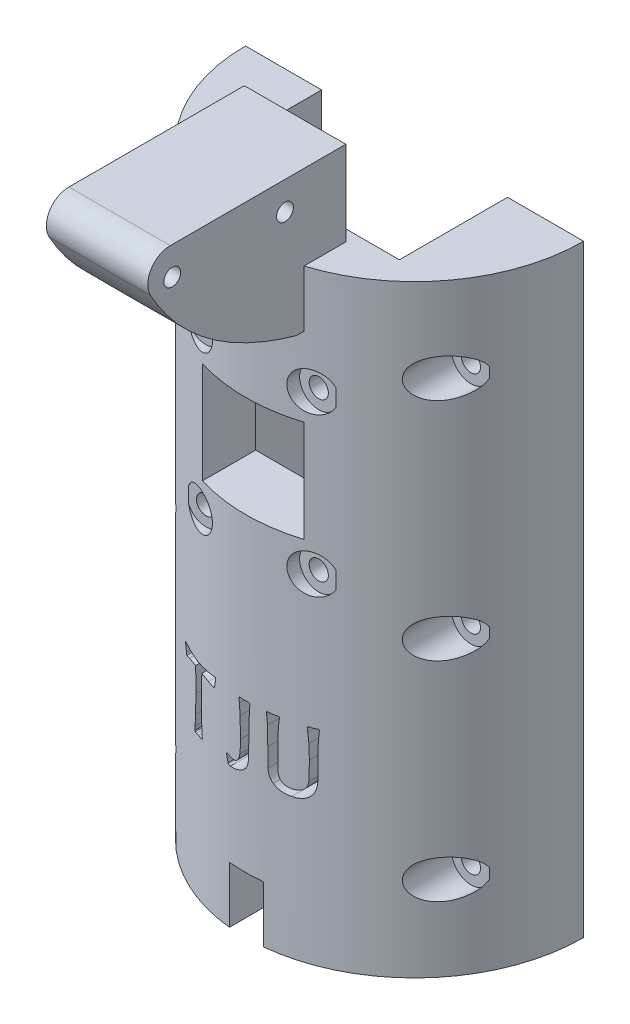
from build123d import *
from build123d.topology import SkipClean

# Parameters (mm, degrees)
EXTRUDE_1_DEPTH      = 80
SKETCH_2_R           = 1.7
CUT_EXTRUDE_1_DEPTH  = 100
SKETCH_3_R           = 1.7
CUT_EXTRUDE_2_DEPTH  = 100
SKETCH_4_R           = 3.4
CUT_EXTRUDE_3_DEPTH  = 26.5
SKETCH_5_R           = 3.4
CUT_EXTRUDE_4_DEPTH  = 13
EXTRUDE_START        = 3
EXTRUDE_2_DEPTH      = 3
EXTRUDE_4_DEPTH      = 9
SKETCH_14_R          = 1.5
CUT_EXTRUDE_6_DEPTH  = 18
SKETCH_18_W          = 18
SKETCH_18_H          = 2
CUT_EXTRUDE_9_DEPTH  = 20
SKETCH_25_W          = 18
SKETCH_25_H          = 38.8
CUT_EXTRUDE_16_DEPTH = 5
FILLET_6_R           = 4
EXTRUDE_START_2      = 19
EXTRUDE_7_DEPTH      = 19
CUT_EXTRUDE_17_REACH = 116.45
SKETCH_29_W          = 30
SKETCH_29_H          = 19.2
EXTRUDE_START_3      = 5
EXTRUDE_9_DEPTH      = 5
SKETCH_31_R          = 3
CUT_EXTRUDE_18_DEPTH = 3
FILLET_7_R           = 1
CHAMFER_3_SIZE       = 2
SKETCH_32_W          = 19.2
SKETCH_32_H          = 102
CUT_EXTRUDE_19_DEPTH = 1.5
SKETCH_33_W          = 19.2
SKETCH_33_H          = 102
CUT_EXTRUDE_20_DEPTH = 1.5
EXTRUDE_10_DEPTH     = 9.5
SKETCH_35_R          = 5
CUT_EXTRUDE_21_DEPTH = 15
SKETCH_36_W          = 6
SKETCH_36_H          = 10
CUT_EXTRUDE_22_DEPTH = 15
SKETCH_39_R          = 1.7
CUT_EXTRUDE_23_DEPTH = 115.450354124
SKETCH_40_R          = 3.4
CUT_EXTRUDE_25_DEPTH = 26.5
SKETCH_41_W          = 18
SKETCH_41_H          = 18
CUT_EXTRUDE_26_DEPTH = 108.354552922
CUT_EXTRUDE_27_DEPTH = 108.354552922
EXTRUDE_11_REACH     = 148.172


with BuildPart() as part:
    # 草图1 → 凸台-拉伸1 (new body)
    with BuildSketch(Plane(origin=(0, 0, 0), x_dir=(1, 0, 0), z_dir=(0, 1, 0))):
        with BuildLine():
            Line((-15, 0), (-30, 0))
            ThreePointArc((-30, 0), (0, -30), (30, 0))
            Line((30, 0), (15, 0))
            Line((15, 0), (15, -19.2))
            Line((15, -19.2), (-15, -19.2))
            Line((-15, -19.2), (-15, 0))
        make_face()
    extrude(amount=EXTRUDE_1_DEPTH)

    # 草图2 → 切除-拉伸1 (cut)
    with BuildSketch(Plane.XY):
        with Locations(Location((-10, 33, 0), (0, 0, 180))):
            Circle(SKETCH_2_R)
        with Locations(Location((-10, 61, 0), (0, 0, 180))):
            Circle(SKETCH_2_R)
        with Locations(Location((10, 33, 0), (0, 0, 180))):
            Circle(SKETCH_2_R)
        with Locations(Location((10, 61, 0), (0, 0, 180))):
            Circle(SKETCH_2_R)
    extrude(amount=CUT_EXTRUDE_1_DEPTH, mode=Mode.SUBTRACT)

    # 草图3 → 切除-拉伸2 (cut)
    with BuildSketch(Plane(origin=(0, 0, 0), x_dir=(-1, 0, 0), z_dir=(0, 0, -1))):
        with Locations((23.5, 65)):
            Circle(SKETCH_3_R)
        with Locations((-23.5, 65)):
            Circle(SKETCH_3_R)
        with Locations((23.5, 25)):
            Circle(SKETCH_3_R)
        with Locations((-23.5, 25)):
            Circle(SKETCH_3_R)
    extrude(amount=-CUT_EXTRUDE_2_DEPTH, mode=Mode.SUBTRACT)

    # 草图4 → 切除-拉伸3 (cut)
    with BuildSketch(Plane(origin=(0, 0, 40), x_dir=(-1, 0, 0), z_dir=(0, 0, -1))):
        with Locations((-23.5, 65)):
            Circle(SKETCH_4_R)
        with Locations((-23.5, 25)):
            Circle(SKETCH_4_R)
        with Locations((23.5, 65)):
            Circle(SKETCH_4_R)
        with Locations((23.5, 25)):
            Circle(SKETCH_4_R)
    extrude(amount=CUT_EXTRUDE_3_DEPTH, mode=Mode.SUBTRACT)

    # 草图5 → 切除-拉伸4 (cut)
    with BuildSketch(Plane(origin=(0, 0, 40), x_dir=(-1, 0, 0), z_dir=(0, 0, -1))):
        with Locations((-10, 33)):
            Circle(SKETCH_5_R)
        with Locations((10, 33)):
            Circle(SKETCH_5_R)
        with Locations((10, 61)):
            Circle(SKETCH_5_R)
        with Locations((-10, 61)):
            Circle(SKETCH_5_R)
    extrude(amount=CUT_EXTRUDE_4_DEPTH, mode=Mode.SUBTRACT)

    # 草图6 → 凸台-拉伸2 (add)
    with SkipClean():  # the faces are left unmerged after this step: merging them gives an invalid solid
        with BuildSketch(Plane.XZ.offset(EXTRUDE_START)):
            with BuildLine():
                Line((-30, 0), (30, 0))
                ThreePointArc((30, 0), (0, 30), (-30, 0))
            make_face()
        extrude(amount=-EXTRUDE_2_DEPTH)

    # 草图13 → 凸台-拉伸4 (add, symmetric)
    with SkipClean():  # the faces are left unmerged after this step: merging them gives an invalid solid
        with BuildSketch(Plane(origin=(0, 0, 0), x_dir=(0, 0, -1), z_dir=(1, 0, 0))):
            with BuildLine():
                Line((-19.2, 100), (-60, 100))
                add(Edge.make_bspline(
                    [(-60, 100), (-54.458111129, 76.859605584), (-30, 70)],
                    knots=[0, 0, 0, 1, 1, 1], degree=2))
                Line((-30, 70), (-19.2, 70))
                Line((-19.2, 70), (-19.2, 100))
            make_face()
        extrude(amount=EXTRUDE_4_DEPTH, both=True)

    # 草图14 → 切除-拉伸6 (cut)
    with SkipClean():  # the faces are left unmerged after this step: merging them gives an invalid solid
        with BuildSketch(Plane.ZY.offset(9)):
            with Locations((32, 90)):
                Circle(SKETCH_14_R)
            with Locations((52, 90)):
                Circle(SKETCH_14_R)
        extrude(amount=-CUT_EXTRUDE_6_DEPTH, mode=Mode.SUBTRACT)

    # 草图18 → 切除-拉伸9 (cut)
    with SkipClean():  # the faces are left unmerged after this step: merging them gives an invalid solid
        with BuildSketch(Plane(origin=(0, 100, 0), x_dir=(1, 0, 0), z_dir=(0, 1, 0))):
            with Locations((0, -20.2)):
                Rectangle(SKETCH_18_W, SKETCH_18_H)
        extrude(amount=-CUT_EXTRUDE_9_DEPTH, mode=Mode.SUBTRACT)

    # 草图25 → 切除-拉伸16 (cut)
    with SkipClean():  # the faces are left unmerged after this step: merging them gives an invalid solid
        with BuildSketch(Plane(origin=(0, 100, 0), x_dir=(1, 0, 0), z_dir=(0, 1, 0))):
            with Locations((0, -40.6)):
                Rectangle(SKETCH_25_W, SKETCH_25_H)
        extrude(amount=-CUT_EXTRUDE_16_DEPTH, mode=Mode.SUBTRACT)

    # 圆角6
    fillet_6_edges = [part.edges().sort_by_distance(p)[0] for p in [
        (4.4999997, 95, 58.513859135),
    ]]
    fillet(fillet_6_edges, radius=FILLET_6_R)

    # 草图28 → 凸台-拉伸7 (add)
    with SkipClean():  # the faces are left unmerged after this step: merging them gives an invalid solid
        with BuildSketch(Plane.XZ.offset(3).offset(EXTRUDE_START_2)):
            with BuildLine():
                Line((-30, 0), (30, 0))
                ThreePointArc((30, 0), (0, 30), (-30, 0))
            make_face()
        extrude(amount=-EXTRUDE_7_DEPTH)

    # 草图29 → 切除-拉伸17 (cut, up to next)
    with BuildSketch(Plane(origin=(0, 0, 0), x_dir=(1, 0, 0), z_dir=(0, 1, 0)), mode=Mode.PRIVATE) as cut_extrude_17_sk1:
        with Locations((0, -9.6)):
            Rectangle(SKETCH_29_W, SKETCH_29_H)
    cut_extrude_17_tool1 = extrude(cut_extrude_17_sk1.sketch, amount=-CUT_EXTRUDE_17_REACH, mode=Mode.PRIVATE) & part.part
    add(cut_extrude_17_tool1.solids().sort_by_distance((0, 0, 9.6))[0], mode=Mode.SUBTRACT)

    # 草图30 → 凸台-拉伸9 (add)
    with SkipClean():  # the faces are left unmerged after this step: merging them gives an invalid solid
        with BuildSketch(Plane.XZ.offset(22).offset(EXTRUDE_START_3)):
            with BuildLine():
                Line((30, 0), (-30, 0))
                ThreePointArc((-30, 0), (0, 30), (30, 0))
            make_face()
        extrude(amount=-EXTRUDE_9_DEPTH)

    # 草图31 → 切除-拉伸18 (cut)
    with SkipClean():  # the faces are left unmerged after this step: merging them gives an invalid solid
        with BuildSketch(Plane(origin=(0, -22, 0), x_dir=(1, 0, 0), z_dir=(0, 1, 0))):
            Circle(SKETCH_31_R)
        extrude(amount=-CUT_EXTRUDE_18_DEPTH, mode=Mode.SUBTRACT)

    # 圆角7
    fillet_7_edges = [part.edges().sort_by_distance(p)[0] for p in [
        (0, -25, 3),
    ]]
    fillet(fillet_7_edges, radius=FILLET_7_R)

    # 倒角3
    chamfer_3_edges = [part.edges().sort_by_distance(p)[0] for p in [
        (0, -22, 3),
    ]]
    chamfer(chamfer_3_edges, length=CHAMFER_3_SIZE - 0.0001)  # a hair under: the kernel refuses the full size

    # 草图32 → 切除-拉伸19 (cut)
    with BuildSketch(Plane.ZY.offset(-15)):
        with Locations((9.6, 29)):
            Rectangle(SKETCH_32_W, SKETCH_32_H)
    extrude(amount=-CUT_EXTRUDE_19_DEPTH, mode=Mode.SUBTRACT)

    # 草图33 → 切除-拉伸20 (cut)
    with BuildSketch(Plane(origin=(-15, 0, 0), x_dir=(0, 0, -1), z_dir=(1, 0, 0))):
        with Locations((-9.6, 29)):
            Rectangle(SKETCH_33_W, SKETCH_33_H)
    extrude(amount=-CUT_EXTRUDE_20_DEPTH, mode=Mode.SUBTRACT)

    # 草图34 → 凸台-拉伸10 (add)
    with BuildSketch(Plane.XZ.offset(27)):
        with BuildLine():
            Line((-6, 0), (6, 0))
            ThreePointArc((6, 0), (0, 6), (-6, 0))
        make_face()
    extrude(amount=EXTRUDE_10_DEPTH)

    # 草图35 → 切除-拉伸21 (cut)
    with BuildSketch(Plane.XZ.offset(27)):
        with Locations(Location((0, 18.5, 0), (0, 0, 270))):
            Circle(SKETCH_35_R)
    extrude(amount=-CUT_EXTRUDE_21_DEPTH, mode=Mode.SUBTRACT)

    # 草图36 → 切除-拉伸22 (cut)
    with BuildSketch(Plane(origin=(0, 0, 19.2), x_dir=(-1, 0, 0), z_dir=(0, 0, -1))):
        with Locations((0, -22)):
            Rectangle(SKETCH_36_W, SKETCH_36_H)
    extrude(amount=-CUT_EXTRUDE_22_DEPTH, mode=Mode.SUBTRACT)

    # 草图39 → 切除-拉伸23 (cut, through all)
    with BuildSketch(Plane(origin=(0, 0, 0), x_dir=(-1, 0, 0), z_dir=(0, 0, -1))):
        with Locations((-23.5, -12)):
            Circle(SKETCH_39_R)
        with Locations((23.5, -12)):
            Circle(SKETCH_39_R)
    extrude(amount=-CUT_EXTRUDE_23_DEPTH, mode=Mode.SUBTRACT)

    # 草图40 → 切除-拉伸25 (cut)
    with BuildSketch(Plane(origin=(0, 0, 40), x_dir=(-1, 0, 0), z_dir=(0, 0, -1))):
        with Locations((-23.5, -12)):
            Circle(SKETCH_40_R)
        with Locations((23.5, -12)):
            Circle(SKETCH_40_R)
    extrude(amount=CUT_EXTRUDE_25_DEPTH, mode=Mode.SUBTRACT)

    # 草图41 → 切除-拉伸26 (cut, through all)
    with BuildSketch(Plane(origin=(0, 0, 40), x_dir=(-1, 0, 0), z_dir=(0, 0, -1))):
        with Locations((0, 47)):
            Rectangle(SKETCH_41_W, SKETCH_41_H)
    extrude(amount=CUT_EXTRUDE_26_DEPTH, mode=Mode.SUBTRACT)

    # 草图43 → 切除-拉伸27 (cut, through all)
    with BuildSketch(Plane(origin=(0, 0, 40), x_dir=(-1, 0, 0), z_dir=(0, 0, -1))):
        with BuildLine():
            add(Edge.make_bspline(
                [(5.85703224, 9.519648867), (5.858467041, 9.502412483), (5.862384195, 9.455355368), (5.878560537, 9.366727745), (5.906137163, 9.242434203), (5.928232605, 9.147531355), (5.940631125, 9.09427807)],
                knots=[0, 0, 0, 0, 0.478148112, 1.305393878, 2.487962906, 4, 4, 4, 4], degree=3))
            add(Edge.make_bspline(
                [(5.940631125, 9.09427807), (5.973233819, 8.951255308), (6.03862516, 8.664394044), (6.076529085, 8.372624541), (6.095534941, 8.226324941)],
                knots=[0, 0, 0, 0, 0.997156331, 2, 2, 2, 2], degree=3))
            add(Edge.make_bspline(
                [(6.095534941, 8.226324941), (6.103411893, 8.181358743), (6.117783107, 8.099319538), (6.178351765, 7.991488751), (6.282121193, 7.931251708), (6.359555236, 7.924826251), (6.400424992, 7.92143489)],
                knots=[0, 0, 0, 0, 1.136989108, 2.074395553, 2.983664298, 4, 4, 4, 4], degree=3))
            add(Edge.make_bspline(
                [(6.400424992, 7.92143489), (6.408632353, 7.92216916), (6.436709982, 7.924681122), (6.494562799, 7.93619372), (6.585664468, 7.950005944), (6.709570808, 7.969681189), (6.86588075, 7.997276158), (7.055243504, 8.029038899), (7.277547265, 8.065598478), (7.436421863, 8.093394636), (7.521633567, 8.108302986)],
                knots=[0, 0, 0, 0, 0.173904883, 0.594933817, 1.243552198, 2.119766021, 3.243472513, 4.594750804, 6.173609309, 8, 8, 8, 8], degree=3))
            add(Edge.make_bspline(
                [(7.521633567, 8.108302986), (7.691956738, 8.135540926), (8.012259045, 8.186763406), (8.462916424, 8.243455806), (8.854047904, 8.267735121), (9.093606631, 8.262944537), (9.203446429, 8.260748011)],
                knots=[0, 0, 0, 0, 1.223498698, 2.300858142, 3.220928408, 4, 4, 4, 4], degree=3))
            add(Edge.make_bspline(
                [(9.203446429, 8.260748011), (9.210278891, 8.130445064), (9.22458498, 7.857611391), (9.241323622, 7.429739874), (9.255966072, 6.965833366), (9.268257485, 6.465046397), (9.277654127, 5.929016105), (9.286004197, 5.356121411), (9.286750559, 4.747953083), (9.288569611, 4.329960295), (9.289504104, 4.115226834)],
                knots=[0, 0, 0, 0, 0.755152602, 1.581169593, 2.478121407, 3.441321042, 4.480296094, 5.580853922, 6.757223506, 8, 8, 8, 8], degree=3))
            add(Edge.make_bspline(
                [(9.289504104, 4.115226834), (9.289240403, 3.807875348), (9.288729157, 3.212005666), (9.278881053, 2.346469525), (9.26176985, 1.537505505), (9.245642118, 1.017139618), (9.237869499, 0.766353854)],
                knots=[0, 0, 0, 0, 1.101138871, 2.134804283, 3.101085324, 4, 4, 4, 4], degree=3))
            add(Edge.make_bspline(
                [(9.237869499, 0.766353854), (9.229221966, 0.604051489), (9.212403119, 0.288384763), (9.181804783, -0.171296269), (9.153594949, -0.604203458), (9.130855099, -0.88352066), (9.119847544, -1.018728219)],
                knots=[0, 0, 0, 0, 1.090173847, 2.120311739, 3.090109524, 4, 4, 4, 4], degree=3))
            add(Edge.make_bspline(
                [(9.119847544, -1.018728219), (9.11561455, -1.070352287), (9.107754739, -1.166207703), (9.098748113, -1.299932398), (9.088400997, -1.412110756), (9.080729439, -1.503058729), (9.076471595, -1.572861981), (9.071762198, -1.621131294), (9.068071716, -1.648954881), (9.068188083, -1.660471512), (9.068212938, -1.662931391)],
                knots=[0, 0, 0, 0, 1.923417826, 3.571396507, 4.976677611, 6.106458477, 6.960802361, 7.572533079, 7.908695778, 8, 8, 8, 8], degree=3))
            add(Edge.make_bspline(
                [(9.068212938, -1.662931391), (9.070298477, -1.697580026), (9.074061196, -1.760092927), (9.106681231, -1.844112661), (9.174488928, -1.89496732), (9.227237146, -1.899199877), (9.255081034, -1.901434093)],
                knots=[0, 0, 0, 0, 1.20974982, 2.182624891, 3.040673024, 4, 4, 4, 4], degree=3))
            add(Edge.make_bspline(
                [(9.255081034, -1.901434093), (9.268206293, -1.900747609), (9.303573331, -1.898897826), (9.37055188, -1.889838214), (9.465066339, -1.881663859), (9.537057432, -1.872255112), (9.57718262, -1.867011022)],
                knots=[0, 0, 0, 0, 0.486650052, 1.31131663, 2.501426745, 4, 4, 4, 4], degree=3))
            add(Edge.make_bspline(
                [(9.57718262, -1.867011022), (9.663952767, -1.85636128), (9.839505839, -1.834814758), (10.016374412, -1.833335873), (10.105822628, -1.832587952)],
                knots=[0, 0, 0, 0, 0.988534648, 2, 2, 2, 2], degree=3))
            add(Edge.make_bspline(
                [(10.105822628, -1.832587952), (10.197882614, -1.834046223), (10.37472372, -1.836847465), (10.548629824, -1.868870217), (10.632003845, -1.884222557)],
                knots=[0, 0, 0, 0, 1.041160493, 2, 2, 2, 2], degree=3))
            add(Edge.make_bspline(
                [(10.632003845, -1.884222557), (10.705678618, -1.89343201), (10.82990157, -1.908960058), (10.954883157, -1.915844319), (11.005740037, -1.918645628)],
                knots=[0, 0, 0, 0, 1.186170037, 2, 2, 2, 2], degree=3))
            add(Edge.make_bspline(
                [(11.005740037, -1.918645628), (11.025750771, -1.917737699), (11.061675748, -1.916107708), (11.108288726, -1.892360211), (11.13929189, -1.851773487), (11.140388989, -1.81840339), (11.140973527, -1.800623672)],
                knots=[0, 0, 0, 0, 1.162316621, 2.086689887, 2.980580887, 4, 4, 4, 4], degree=3))
            add(Edge.make_bspline(
                [(11.140973527, -1.800623672), (11.140071683, -1.796536565), (11.136687401, -1.781199197), (11.136887373, -1.746253567), (11.126723352, -1.689294916), (11.117836822, -1.609763929), (11.108719755, -1.506245847), (11.093301569, -1.381002893), (11.076064883, -1.231842822), (11.063915694, -1.125277939), (11.057374642, -1.067904034)],
                knots=[0, 0, 0, 0, 0.135985939, 0.510303709, 1.128887405, 2.015407267, 3.114029169, 4.510020151, 6.121015412, 8, 8, 8, 8], degree=3))
            add(Edge.make_bspline(
                [(11.057374642, -1.067904034), (11.02436773, -0.764051891), (10.956233839, -0.136830882), (10.922382136, 0.493180826), (10.904929617, 0.817988459)],
                knots=[0, 0, 0, 0, 0.96888382, 2, 2, 2, 2], degree=3))
            add(Edge.make_bspline(
                [(10.904929617, 0.817988459), (10.891836627, 1.067930669), (10.865015209, 1.57994547), (10.839248059, 2.367708145), (10.820798423, 3.193911431), (10.819523939, 3.757871356), (10.818871941, 4.046380693)],
                knots=[0, 0, 0, 0, 0.929842291, 1.904812378, 2.928148678, 4, 4, 4, 4], degree=3))
            add(Edge.make_bspline(
                [(10.818871941, 4.046380693), (10.819493811, 4.29389979), (10.820688144, 4.769272238), (10.825551709, 5.452823181), (10.83290632, 6.076545161), (10.842000052, 6.639648786), (10.855859487, 7.142973485), (10.877272137, 7.586237526), (10.893994432, 7.970123569), (10.913314811, 8.2050559), (10.922141152, 8.312382617)],
                knots=[0, 0, 0, 0, 1.391782816, 2.672986505, 3.843634034, 4.899147726, 5.839693802, 6.674651578, 7.394526524, 8, 8, 8, 8], degree=3))
            add(Edge.make_bspline(
                [(10.922141152, 8.312382617), (11.085352662, 8.306777504), (11.411534895, 8.295575547), (11.898047299, 8.247012115), (12.381259635, 8.17816025), (12.698573667, 8.108636927), (12.85720946, 8.073879915)],
                knots=[0, 0, 0, 0, 1.003129854, 2.004779782, 3.002523341, 4, 4, 4, 4], degree=3))
            add(Edge.make_bspline(
                [(12.85720946, 8.073879915), (12.930961943, 8.054797382), (13.067682692, 8.019422597), (13.257139097, 7.973753388), (13.414578206, 7.933228082), (13.532472325, 7.895878387), (13.632772983, 7.874617173), (13.671080582, 7.853974104), (13.726987451, 7.842782558), (13.712269343, 7.837057071), (13.707951054, 7.835377214)],
                knots=[0, 0, 0, 0, 2.023228837, 3.750617617, 5.192897582, 6.302840761, 7.137627747, 7.668013828, 7.902595332, 8, 8, 8, 8], degree=3))
            add(Edge.make_bspline(
                [(13.707951054, 7.835377214), (13.73216587, 7.839481448), (13.782846668, 7.848071473), (13.840434118, 7.917124698), (13.877166273, 8.017313641), (13.888409436, 8.097189138), (13.894819149, 8.142726056)],
                knots=[0, 0, 0, 0, 0.732569965, 1.533244296, 2.593705774, 4, 4, 4, 4], degree=3))
            add(Edge.make_bspline(
                [(13.894819149, 8.142726056), (13.916179678, 8.29118672), (13.959339311, 8.591156242), (14.052064874, 8.879696017), (14.09889878, 9.025431929)],
                knots=[0, 0, 0, 0, 0.989838319, 2, 2, 2, 2], degree=3))
            add(Edge.make_bspline(
                [(14.09889878, 9.025431929), (14.121449471, 9.090869841), (14.160554974, 9.204346734), (14.205465313, 9.350198281), (14.238026922, 9.442580497), (14.248233684, 9.488457931), (14.251343806, 9.502437332)],
                knots=[0, 0, 0, 0, 1.657740955, 2.874714227, 3.657112006, 4, 4, 4, 4], degree=3))
            add(Edge.make_bspline(
                [(14.251343806, 9.502437332), (14.249551304, 9.52530497), (14.246086841, 9.569502447), (14.201199202, 9.624531722), (14.129771063, 9.650312813), (14.076949283, 9.653238283), (14.047264175, 9.654882357)],
                knots=[0, 0, 0, 0, 0.934583354, 1.806317963, 2.767181093, 4, 4, 4, 4], degree=3))
            add(Edge.make_bspline(
                [(14.047264175, 9.654882357), (14.028414262, 9.654058206), (13.976771919, 9.651800312), (13.876612308, 9.647621547), (13.732630648, 9.633176164), (13.544057516, 9.619329436), (13.311889902, 9.603168566), (13.036004535, 9.576401208), (12.715327964, 9.5510396), (12.486732307, 9.530530128), (12.365451313, 9.519648867)],
                knots=[0, 0, 0, 0, 0.268375882, 0.735258529, 1.42551662, 2.325865387, 3.424704897, 4.735539188, 6.268046483, 8, 8, 8, 8], degree=3))
            add(Edge.make_bspline(
                [(12.365451313, 9.519648867), (12.240075376, 9.508715989), (11.997593787, 9.487571409), (11.645030874, 9.461392495), (11.31567878, 9.435813064), (11.009113561, 9.416422385), (10.725534984, 9.401043175), (10.464824971, 9.392155806), (10.226358376, 9.383438298), (10.074685076, 9.382434137), (10.002553417, 9.381956586)],
                knots=[0, 0, 0, 0, 1.275758837, 2.467363653, 3.583779202, 4.624448483, 5.581208992, 6.462521565, 7.268817456, 8, 8, 8, 8], degree=3))
            add(Edge.make_bspline(
                [(10.002553417, 9.381956586), (9.929604422, 9.382490092), (9.775477792, 9.383617285), (9.53366064, 9.391400144), (9.26810842, 9.404073233), (8.980379078, 9.420890338), (8.669082137, 9.44440504), (8.335228863, 9.4672003), (7.978846994, 9.500377022), (7.733896819, 9.524454812), (7.607691242, 9.536860402)],
                knots=[0, 0, 0, 0, 0.72927492, 1.540811991, 2.418482048, 3.387024563, 4.422046326, 5.539381905, 6.73221677, 8, 8, 8, 8], degree=3))
            add(Edge.make_bspline(
                [(7.607691242, 9.536860402), (7.485587182, 9.547700335), (7.256973303, 9.567995803), (6.93713979, 9.593646301), (6.665331182, 9.62011389), (6.441357322, 9.636254006), (6.265865916, 9.649901771), (6.138355724, 9.664852438), (6.057790499, 9.668199043), (6.020129203, 9.671235169), (6.009477265, 9.672093892)],
                knots=[0, 0, 0, 0, 1.834207314, 3.43416304, 4.800927602, 5.920205504, 6.794019528, 7.434664168, 7.840103157, 8, 8, 8, 8], degree=3))
            add(Edge.make_bspline(
                [(6.009477265, 9.672093892), (5.987162051, 9.670356216), (5.94618554, 9.667165392), (5.889287527, 9.639838605), (5.86196074, 9.582940592), (5.858769916, 9.541964082), (5.85703224, 9.519648867)],
                knots=[0, 0, 0, 0, 1.089171063, 2, 2.910828937, 4, 4, 4, 4], degree=3))
        make_face()
        with BuildLine():
            add(Edge.make_bspline(
                [(-0.776785161, 9.177876955), (-0.776789947, 9.177057099), (-0.776838071, 9.168813133), (-0.773045128, 9.146747745), (-0.768351918, 9.104230718), (-0.764227495, 9.040130169), (-0.756801074, 8.955722985), (-0.746016033, 8.850966725), (-0.737239969, 8.725408634), (-0.729392953, 8.634472144), (-0.725150555, 8.585308388)],
                knots=[0, 0, 0, 0, 0.033067086, 0.332502286, 0.898519627, 1.760803736, 2.922395452, 4.317497343, 6.009097776, 8, 8, 8, 8], degree=3))
            add(Edge.make_bspline(
                [(-0.725150555, 8.585308388), (-0.713938706, 8.453393466), (-0.690486347, 8.177460756), (-0.665066818, 7.742049312), (-0.638873011, 7.267614175), (-0.629301954, 6.93713169), (-0.624340135, 6.765803245)],
                knots=[0, 0, 0, 0, 0.87163953, 1.823249811, 2.871531042, 4, 4, 4, 4], degree=3))
            add(Edge.make_bspline(
                [(-0.624340135, 6.765803245), (-0.619985942, 6.633855129), (-0.611062121, 6.363430441), (-0.60231242, 5.947842405), (-0.591629974, 5.513491265), (-0.584327639, 5.059420632), (-0.580278079, 4.586493188), (-0.574514459, 4.094748741), (-0.57222354, 3.584130101), (-0.572542604, 3.237438571), (-0.57270553, 3.060405609)],
                knots=[0, 0, 0, 0, 0.8549669, 1.752235381, 2.691954866, 3.668718843, 4.69317817, 5.754790134, 6.853516402, 8, 8, 8, 8], degree=3))
            add(Edge.make_bspline(
                [(-0.57270553, 3.060405609), (-0.572872379, 2.90468227), (-0.573189394, 2.608805529), (-0.571067866, 2.187518664), (-0.56538685, 1.812157447), (-0.56126684, 1.481834531), (-0.554453456, 1.196561071), (-0.54374046, 0.956486793), (-0.535702802, 0.761225955), (-0.525515052, 0.64666945), (-0.521070924, 0.596697293)],
                knots=[0, 0, 0, 0, 1.516274391, 2.880944677, 4.102048895, 5.171540464, 6.097575414, 6.880304974, 7.511563528, 8, 8, 8, 8], degree=3))
            add(Edge.make_bspline(
                [(-0.521070924, 0.596697293), (-0.511331341, 0.500693474), (-0.492628061, 0.316333808), (-0.450867438, 0.051046102), (-0.397607766, -0.192316708), (-0.331509125, -0.414381749), (-0.253678251, -0.614985564), (-0.161128801, -0.792420928), (-0.063330275, -0.952449006), (0.01765121, -1.041922416), (0.056744898, -1.085115569)],
                knots=[0, 0, 0, 0, 1.278825999, 2.45577659, 3.557476532, 4.578220771, 5.524324972, 6.403714446, 7.229395581, 8, 8, 8, 8], degree=3))
            add(Edge.make_bspline(
                [(0.056744898, -1.085115569), (0.140842744, -1.168488236), (0.309090913, -1.335285597), (0.59669309, -1.545219849), (0.907143063, -1.72500565), (1.243907269, -1.868764273), (1.603864428, -1.9856808), (1.990447393, -2.066159925), (2.401314597, -2.112038115), (2.683437069, -2.119107686), (2.827802055, -2.122725259)],
                knots=[0, 0, 0, 0, 0.932353484, 1.86528878, 2.797261652, 3.755033065, 4.745961936, 5.776130153, 6.862022799, 8, 8, 8, 8], degree=3))
            add(Edge.make_bspline(
                [(2.827802055, -2.122725259), (2.882255049, -2.120416277), (2.982698823, -2.116157138), (3.119533478, -2.072484184), (3.225414518, -1.993467225), (3.265319082, -1.920473755), (3.285137132, -1.884222557)],
                knots=[0, 0, 0, 0, 1.189903504, 2.194891271, 3.103517705, 4, 4, 4, 4], degree=3))
            add(Edge.make_bspline(
                [(3.285137132, -1.884222557), (3.307909568, -1.777636389), (3.352785285, -1.567596029), (3.39971463, -1.358005004), (3.422829413, -1.25477213)],
                knots=[0, 0, 0, 0, 1.014911304, 2, 2, 2, 2], degree=3))
            add(Edge.make_bspline(
                [(3.422829413, -1.25477213), (3.435525906, -1.208977527), (3.459270647, -1.123333327), (3.486434611, -1.002655956), (3.515488855, -0.902766582), (3.53402572, -0.820131833), (3.551016604, -0.757087493), (3.564283657, -0.713258675), (3.569625748, -0.687815204), (3.574427437, -0.67858456), (3.575274439, -0.676956307)],
                knots=[0, 0, 0, 0, 1.907736555, 3.567812814, 4.964700659, 6.08207527, 6.968114903, 7.582862527, 7.926418414, 8, 8, 8, 8], degree=3))
            add(Edge.make_bspline(
                [(3.575274439, -0.676956307), (3.57378562, -0.64687573), (3.571046259, -0.59152879), (3.528683454, -0.519801674), (3.455983627, -0.480104038), (3.401199323, -0.477022938), (3.371194808, -0.475335467)],
                knots=[0, 0, 0, 0, 1.091159656, 2.007685779, 2.908840344, 4, 4, 4, 4], degree=3))
            add(Edge.make_bspline(
                [(3.371194808, -0.475335467), (3.358040858, -0.47846823), (3.317143207, -0.488208471), (3.235696806, -0.516836312), (3.113961702, -0.567396921), (3.018007762, -0.605786831), (2.963035546, -0.627780492)],
                knots=[0, 0, 0, 0, 0.371943426, 1.156429287, 2.37091227, 4, 4, 4, 4], degree=3))
            add(Edge.make_bspline(
                [(2.963035546, -0.627780492), (2.833905723, -0.671617602), (2.580106467, -0.757777606), (2.312561564, -0.772831066), (2.181140092, -0.780225518)],
                knots=[0, 0, 0, 0, 1.017574475, 2, 2, 2, 2], degree=3))
            add(Edge.make_bspline(
                [(2.181140092, -0.780225518), (2.108425954, -0.775473863), (1.966898382, -0.766225453), (1.764390494, -0.693540277), (1.585199672, -0.572454646), (1.426836919, -0.40362186), (1.290855953, -0.189289125), (1.172027162, 0.070136816), (1.078903585, 0.376818834), (1.032702807, 0.597920629), (1.008296912, 0.714719248)],
                knots=[0, 0, 0, 0, 0.840613191, 1.63613222, 2.457448301, 3.323451566, 4.297505116, 5.384667271, 6.618431603, 8, 8, 8, 8], degree=3))
            add(Edge.make_bspline(
                [(1.008296912, 0.714719248), (0.999506677, 0.772018162), (0.980226925, 0.897692712), (0.962880659, 1.103069723), (0.945308916, 1.340730493), (0.930420322, 1.609582365), (0.921607346, 1.910474628), (0.914109478, 2.243238365), (0.909326451, 2.607975669), (0.908115424, 2.862061857), (0.907486492, 2.994018259)],
                knots=[0, 0, 0, 0, 0.609164827, 1.336090177, 2.165315449, 3.114362188, 4.165943723, 5.329241217, 6.612975697, 8, 8, 8, 8], degree=3))
            add(Edge.make_bspline(
                [(0.907486492, 2.994018259), (0.908510966, 3.328419128), (0.910489678, 3.974295004), (0.923305803, 4.908658334), (0.940970062, 5.775113619), (0.963199873, 6.329803975), (0.973873842, 6.596146684)],
                knots=[0, 0, 0, 0, 1.113740359, 2.151124882, 3.112235497, 4, 4, 4, 4], degree=3))
            add(Edge.make_bspline(
                [(0.973873842, 6.596146684), (0.982417109, 6.766649251), (0.999017191, 7.097946016), (1.030978863, 7.57992559), (1.067930137, 8.032315513), (1.095688893, 8.323884637), (1.109107332, 8.464827642)],
                knots=[0, 0, 0, 0, 1.093282708, 2.1243142, 3.09330319, 4, 4, 4, 4], degree=3))
            add(Edge.make_bspline(
                [(1.109107332, 8.464827642), (1.115198165, 8.519707102), (1.126552564, 8.622012222), (1.13728797, 8.765743092), (1.150441788, 8.887706957), (1.159898663, 8.989368039), (1.168453154, 9.070413262), (1.170798027, 9.131356431), (1.178493167, 9.170363377), (1.178078881, 9.189343143), (1.177953473, 9.19508849)],
                knots=[0, 0, 0, 0, 1.806239627, 3.36715337, 4.714482847, 5.819029443, 6.707502557, 7.379965633, 7.812309989, 8, 8, 8, 8], degree=3))
            add(Edge.make_bspline(
                [(1.177953473, 9.19508849), (1.174941645, 9.230080125), (1.169357958, 9.294951793), (1.119632594, 9.382060603), (1.027761913, 9.427478871), (0.959552728, 9.431429836), (0.922239237, 9.433591191)],
                knots=[0, 0, 0, 0, 1.05181703, 1.949983884, 2.878549027, 4, 4, 4, 4], degree=3))
            add(Edge.make_bspline(
                [(0.922239237, 9.433591191), (0.912406743, 9.432748184), (0.882909261, 9.430219164), (0.824399993, 9.426465667), (0.738817544, 9.411768533), (0.672305687, 9.403729953), (0.634560721, 9.399168121)],
                knots=[0, 0, 0, 0, 0.408640617, 1.225921851, 2.425732015, 4, 4, 4, 4], degree=3))
            add(Edge.make_bspline(
                [(0.634560721, 9.399168121), (0.551802844, 9.394466969), (0.392917778, 9.385441328), (0.233795949, 9.383085394), (0.157555318, 9.381956586)],
                knots=[0, 0, 0, 0, 1.041732601, 2, 2, 2, 2], degree=3))
            add(Edge.make_bspline(
                [(0.157555318, 9.381956586), (0.108367596, 9.383337313), (-0.01058444, 9.386676365), (-0.129327555, 9.394550191), (-0.198969338, 9.399168121)],
                knots=[0, 0, 0, 0, 0.827017747, 2, 2, 2, 2], degree=3))
            add(Edge.make_bspline(
                [(-0.198969338, 9.399168121), (-0.237476992, 9.401886108), (-0.307914813, 9.406857824), (-0.403117989, 9.410054923), (-0.477543857, 9.417352049), (-0.520241272, 9.416668486), (-0.538282459, 9.416379656)],
                knots=[0, 0, 0, 0, 1.362982669, 2.493154516, 3.363303821, 4, 4, 4, 4], degree=3))
            add(Edge.make_bspline(
                [(-0.538282459, 9.416379656), (-0.573216168, 9.414192539), (-0.637666047, 9.410157484), (-0.724029913, 9.363624408), (-0.770562988, 9.277260542), (-0.774598043, 9.212810663), (-0.776785161, 9.177876955)],
                knots=[0, 0, 0, 0, 1.084058164, 2, 2.915941836, 4, 4, 4, 4], degree=3))
        make_face()
        with BuildLine():
            add(Edge.make_bspline(
                [(-11.027483731, 9.22951156), (-11.026645807, 9.225416746), (-11.020997183, 9.197812725), (-11.012867968, 9.12546133), (-10.998413178, 8.993439935), (-10.985776502, 8.885278416), (-10.978307916, 8.821352298)],
                knots=[0, 0, 0, 0, 0.121969038, 0.82221939, 2.1218535, 4, 4, 4, 4], degree=3))
            add(Edge.make_bspline(
                [(-10.978307916, 8.821352298), (-10.967033308, 8.728801109), (-10.942826856, 8.530094796), (-10.917567497, 8.20765366), (-10.89226706, 7.841348608), (-10.880981226, 7.58133751), (-10.875038705, 7.444429487)],
                knots=[0, 0, 0, 0, 0.809958149, 1.738970615, 2.80946212, 4, 4, 4, 4], degree=3))
            add(Edge.make_bspline(
                [(-10.875038705, 7.444429487), (-10.870735862, 7.339528681), (-10.861829181, 7.122388982), (-10.852100785, 6.785511294), (-10.845703036, 6.428126609), (-10.837158814, 6.04950452), (-10.833506989, 5.651147439), (-10.82760458, 5.231532596), (-10.82539204, 4.791396427), (-10.825703396, 4.490602169), (-10.825862891, 4.336518)],
                knots=[0, 0, 0, 0, 0.810588556, 1.677879896, 2.601947894, 3.570302251, 4.601827123, 5.677644078, 6.81035534, 8, 8, 8, 8], degree=3))
            add(Edge.make_bspline(
                [(-10.825862891, 4.336518), (-10.825532815, 4.270946981), (-10.824761186, 4.117659407), (-10.832750604, 3.853809885), (-10.8318818, 3.522620024), (-10.837532974, 3.27923011), (-10.840615635, 3.146463284)],
                knots=[0, 0, 0, 0, 0.6610885, 1.545448814, 2.661066263, 4, 4, 4, 4], degree=3))
            add(Edge.make_bspline(
                [(-10.840615635, 3.146463284), (-10.843316167, 3.031723779), (-10.848408362, 2.815367964), (-10.851950233, 2.510442903), (-10.858958628, 2.245752381), (-10.858182191, 2.082629922), (-10.85782717, 2.008043175)],
                knots=[0, 0, 0, 0, 1.209606424, 2.280865536, 3.213936278, 4, 4, 4, 4], degree=3))
            add(Edge.make_bspline(
                [(-10.85782717, 2.008043175), (-10.8540845, 1.903120736), (-10.846800623, 1.698923682), (-10.830282535, 1.401225395), (-10.805585363, 1.120880151), (-10.784466165, 0.940064775), (-10.774228285, 0.85241153)],
                knots=[0, 0, 0, 0, 1.086935212, 2.115362281, 3.086390685, 4, 4, 4, 4], degree=3))
            add(Edge.make_bspline(
                [(-10.774228285, 0.85241153), (-10.756428378, 0.731590711), (-10.721787941, 0.496461053), (-10.640103257, 0.158472392), (-10.536535136, -0.155406125), (-10.413278121, -0.446524518), (-10.272115576, -0.717214388), (-10.102677849, -0.960909293), (-9.91611049, -1.183525711), (-9.707234706, -1.383086224), (-9.475028687, -1.556828527), (-9.22358245, -1.710221363), (-8.950224828, -1.839549415), (-8.654421149, -1.941098959), (-8.338651802, -2.022184394), (-8.002569369, -2.081441946), (-7.644891636, -2.115446891), (-7.399200922, -2.120254195), (-7.27291028, -2.122725259)],
                knots=[0, 0, 0, 0, 1.142897697, 2.224195684, 3.250601778, 4.233972128, 5.181389525, 6.102974854, 7.006852793, 7.896946294, 8.800856803, 9.716770585, 10.650384207, 11.625939887, 12.640228102, 13.699910597, 14.817701482, 16, 16, 16, 16], degree=3))
            add(Edge.make_bspline(
                [(-7.27291028, -2.122725259), (-7.132660583, -2.119787164), (-6.858895345, -2.114052049), (-6.460744474, -2.072633031), (-6.087054311, -2.001830686), (-5.737781667, -1.90093078), (-5.412626426, -1.770335807), (-5.11055177, -1.613533811), (-4.834518042, -1.425267304), (-4.670018961, -1.278736021), (-4.587910798, -1.205596315)],
                knots=[0, 0, 0, 0, 1.156904424, 2.258259541, 3.297883553, 4.290722296, 5.252477038, 6.183975837, 7.093548687, 8, 8, 8, 8], degree=3))
            add(Edge.make_bspline(
                [(-4.587910798, -1.205596315), (-4.525080988, -1.140395194), (-4.40055034, -1.011164537), (-4.238115498, -0.796768464), (-4.094384743, -0.571647044), (-3.976530275, -0.329997214), (-3.877140925, -0.076274131), (-3.801879901, 0.192340588), (-3.746375256, 0.474362062), (-3.728876804, 0.667771269), (-3.719957669, 0.766353854)],
                knots=[0, 0, 0, 0, 0.985184386, 1.952666232, 2.923271382, 3.889146559, 4.875260231, 5.886614393, 6.922786457, 8, 8, 8, 8], degree=3))
            add(Edge.make_bspline(
                [(-3.719957669, 0.766353854), (-3.719957669, 0.770451838), (-3.719957669, 0.787663374), (-3.719957669, 0.827004025), (-3.719957669, 0.892571778), (-3.719957669, 0.983547035), (-3.719957669, 1.100749394), (-3.719957669, 1.243359256), (-3.719957669, 1.413015817), (-3.719957669, 1.608079882), (-3.719957669, 1.829371048), (-3.719957669, 2.076069718), (-3.719957669, 2.34899549), (-3.719957669, 2.648967959), (-3.719957669, 2.974347933), (-3.719957669, 3.325955008), (-3.719957669, 3.702969587), (-3.719957669, 3.963601405), (-3.719957669, 4.098015298)],
                knots=[0, 0, 0, 0, 0.05904059, 0.24797048, 0.566789668, 1.003690037, 1.558671587, 2.255350554, 3.058302583, 4.00295203, 5.065682657, 6.246494465, 7.557195572, 8.997785978, 10.568265683, 12.24501845, 14.063468635, 16, 16, 16, 16], degree=3))
            add(Edge.make_bspline(
                [(-3.719957669, 4.098015298), (-3.720117547, 4.260295453), (-3.720430037, 4.577481559), (-3.71820324, 5.042204757), (-3.712339271, 5.485589459), (-3.708588902, 5.908530959), (-3.70020087, 6.31010631), (-3.693670451, 6.690434999), (-3.683917655, 7.049438282), (-3.675077865, 7.282156138), (-3.670781855, 7.395253673)],
                knots=[0, 0, 0, 0, 1.181007808, 2.308349223, 3.382058957, 4.408054287, 5.386426426, 6.305162331, 7.176333243, 8, 8, 8, 8], degree=3))
            add(Edge.make_bspline(
                [(-3.670781855, 7.395253673), (-3.662339868, 7.53708677), (-3.646424013, 7.804487721), (-3.615322302, 8.18132043), (-3.589133699, 8.509733521), (-3.562506656, 8.711605047), (-3.550301109, 8.804140763)],
                knots=[0, 0, 0, 0, 1.205448581, 2.2726578, 3.208205077, 4, 4, 4, 4], degree=3))
            add(Edge.make_bspline(
                [(-3.550301109, 8.804140763), (-3.545115337, 8.873282335), (-3.536486075, 8.988335772), (-3.50439462, 9.066021858), (-3.51534208, 9.19531708), (-3.499504366, 9.178753232), (-3.498666503, 9.177876955)],
                knots=[0, 0, 0, 0, 1.99118818, 3.31339078, 3.963676301, 4, 4, 4, 4], degree=3))
            add(Edge.make_bspline(
                [(-3.498666503, 9.177876955), (-3.499847584, 9.216148928), (-3.501941887, 9.284013119), (-3.543388276, 9.371476028), (-3.614181469, 9.428533358), (-3.672193755, 9.431846378), (-3.702746134, 9.433591191)],
                knots=[0, 0, 0, 0, 1.222909686, 2.168473919, 3.035420198, 4, 4, 4, 4], degree=3))
            add(Edge.make_bspline(
                [(-3.702746134, 9.433591191), (-3.725693577, 9.432805129), (-3.778171544, 9.431007502), (-3.866952445, 9.427077702), (-3.974018014, 9.41285077), (-4.051883519, 9.403948336), (-4.093693861, 9.399168121)],
                knots=[0, 0, 0, 0, 0.701725742, 1.604760063, 2.713861778, 4, 4, 4, 4], degree=3))
            add(Edge.make_bspline(
                [(-4.093693861, 9.399168121), (-4.17317368, 9.394546513), (-4.309139442, 9.38664035), (-4.445290288, 9.383331304), (-4.501853123, 9.381956586)],
                knots=[0, 0, 0, 0, 1.16911519, 2, 2, 2, 2], degree=3))
            add(Edge.make_bspline(
                [(-4.501853123, 9.381956586), (-4.561697731, 9.383249881), (-4.697864201, 9.386192559), (-4.833812698, 9.39450754), (-4.910012384, 9.399168121)],
                knots=[0, 0, 0, 0, 0.878991855, 2, 2, 2, 2], degree=3))
            add(Edge.make_bspline(
                [(-4.910012384, 9.399168121), (-4.981176312, 9.409820268), (-5.105144889, 9.428376461), (-5.230397142, 9.432033478), (-5.283748576, 9.433591191)],
                knots=[0, 0, 0, 0, 1.148096221, 2, 2, 2, 2], degree=3))
            add(Edge.make_bspline(
                [(-5.283748576, 9.433591191), (-5.318682285, 9.431404074), (-5.383132163, 9.427369019), (-5.469496029, 9.380835943), (-5.516029105, 9.294472077), (-5.52006416, 9.230022199), (-5.522251277, 9.19508849)],
                knots=[0, 0, 0, 0, 1.084058164, 2, 2.915941836, 4, 4, 4, 4], degree=3))
            add(Edge.make_bspline(
                [(-5.522251277, 9.19508849), (-5.520552438, 9.193480218), (-5.501178319, 9.175138955), (-5.511692404, 9.093128246), (-5.47399262, 8.967578753), (-5.46109639, 8.85595808), (-5.453405137, 8.789388019)],
                knots=[0, 0, 0, 0, 0.067385153, 0.768482252, 2.072737508, 4, 4, 4, 4], degree=3))
            add(Edge.make_bspline(
                [(-5.453405137, 8.789388019), (-5.442230009, 8.696827449), (-5.417934964, 8.495598135), (-5.390655931, 8.169872773), (-5.359886029, 7.797920338), (-5.343864093, 7.534624425), (-5.335383181, 7.395253673)],
                knots=[0, 0, 0, 0, 0.799451053, 1.738029355, 2.802668269, 4, 4, 4, 4], degree=3))
            add(Edge.make_bspline(
                [(-5.335383181, 7.395253673), (-5.329157002, 7.287088495), (-5.316285289, 7.06347284), (-5.306057728, 6.71661717), (-5.292594476, 6.348683986), (-5.283232001, 5.959347717), (-5.275589133, 5.54954388), (-5.271812936, 5.118410785), (-5.265113774, 4.666012919), (-5.266055137, 4.357010649), (-5.266537041, 4.198825719)],
                knots=[0, 0, 0, 0, 0.81316305, 1.681095444, 2.604360286, 3.576637515, 4.604134208, 5.680748912, 6.812725318, 8, 8, 8, 8], degree=3))
            add(Edge.make_bspline(
                [(-5.266537041, 4.198825719), (-5.266372398, 3.980813), (-5.266059205, 3.56609537), (-5.268153902, 2.976795023), (-5.27385163, 2.453082557), (-5.277949177, 1.995729601), (-5.284719349, 1.603919623), (-5.29550939, 1.277774643), (-5.303283201, 1.016977215), (-5.313714089, 0.865506661), (-5.318171646, 0.800776924)],
                knots=[0, 0, 0, 0, 1.539414017, 2.928371051, 4.161114057, 5.237608642, 6.157948465, 6.928003501, 7.541890819, 8, 8, 8, 8], degree=3))
            add(Edge.make_bspline(
                [(-5.318171646, 0.800776924), (-5.334044223, 0.675993044), (-5.364873301, 0.433627097), (-5.486786552, 0.095015408), (-5.659013316, -0.208977688), (-5.816867892, -0.374940407), (-5.895987469, -0.458123932)],
                knots=[0, 0, 0, 0, 1.063245602, 2.065126724, 3.030206423, 4, 4, 4, 4], degree=3))
            add(Edge.make_bspline(
                [(-5.895987469, -0.458123932), (-5.939308614, -0.496246046), (-6.026732937, -0.573178454), (-6.176119047, -0.666520119), (-6.333091038, -0.752550548), (-6.504709051, -0.817938326), (-6.688108467, -0.870194223), (-6.884120122, -0.905910247), (-7.092057066, -0.928786653), (-7.234325752, -0.931353383), (-7.30733335, -0.932670543)],
                knots=[0, 0, 0, 0, 0.90660765, 1.829581381, 2.764285833, 3.719934206, 4.712050854, 5.761846806, 6.851453596, 8, 8, 8, 8], degree=3))
            add(Edge.make_bspline(
                [(-7.30733335, -0.932670543), (-7.393430423, -0.931267715), (-7.56100624, -0.928537308), (-7.805273821, -0.907006553), (-8.034425319, -0.867241892), (-8.248558912, -0.814143581), (-8.44746402, -0.744334803), (-8.632210563, -0.661192946), (-8.80355596, -0.562665218), (-8.958856644, -0.447187064), (-9.097314094, -0.314424387), (-9.224028917, -0.170322305), (-9.331582343, -0.007638554), (-9.429473749, 0.166921975), (-9.506940226, 0.360054741), (-9.569949732, 0.567679428), (-9.623564546, 0.788977187), (-9.643043722, 0.943123968), (-9.65301971, 1.02206809)],
                knots=[0, 0, 0, 0, 1.208882527, 2.352919435, 3.438931306, 4.471684294, 5.44712477, 6.394810809, 7.312678976, 8.21724769, 9.104594802, 10.002107948, 10.905431253, 11.837688405, 12.807955538, 13.819915973, 14.883500405, 16, 16, 16, 16], degree=3))
            add(Edge.make_bspline(
                [(-9.65301971, 1.02206809), (-9.658159004, 1.081060973), (-9.670424343, 1.221852233), (-9.685147806, 1.46692941), (-9.692660567, 1.779372564), (-9.703629595, 2.157977294), (-9.710432646, 2.603053201), (-9.714383597, 3.115317593), (-9.720905034, 3.694760481), (-9.719924072, 4.10375034), (-9.71940706, 4.319306464)],
                knots=[0, 0, 0, 0, 0.430830369, 1.02821134, 1.78589877, 2.704523701, 3.783990473, 5.024369655, 6.431708436, 8, 8, 8, 8], degree=3))
            add(Edge.make_bspline(
                [(-9.71940706, 4.319306464), (-9.716599522, 4.757047961), (-9.711114051, 5.612323539), (-9.672077051, 6.466720196), (-9.65301971, 6.8838252)],
                knots=[0, 0, 0, 0, 1.023626787, 2, 2, 2, 2], degree=3))
            add(Edge.make_bspline(
                [(-9.65301971, 6.8838252), (-9.634312332, 7.161916377), (-9.597607155, 7.707550584), (-9.530849463, 8.250322632), (-9.498115894, 8.516462247)],
                knots=[0, 0, 0, 0, 1.019331903, 2, 2, 2, 2], degree=3))
            add(Edge.make_bspline(
                [(-9.498115894, 8.516462247), (-9.493557031, 8.568133198), (-9.485084235, 8.664165358), (-9.468108758, 8.797372813), (-9.460152246, 8.910000523), (-9.449866929, 9.001680867), (-9.441176448, 9.072009228), (-9.439645751, 9.121692742), (-9.431415597, 9.149013796), (-9.431673898, 9.160660275), (-9.431728544, 9.163124211)],
                knots=[0, 0, 0, 0, 1.914528308, 3.55821375, 4.955077774, 6.080940441, 6.962943304, 7.571009996, 7.909242654, 8, 8, 8, 8], degree=3))
            add(Edge.make_bspline(
                [(-9.431728544, 9.163124211), (-9.433364562, 9.203097954), (-9.436363929, 9.27638315), (-9.487808249, 9.371751669), (-9.578468794, 9.426456319), (-9.647327627, 9.431068797), (-9.68498399, 9.433591191)],
                knots=[0, 0, 0, 0, 1.125215119, 2.062894385, 2.940668208, 4, 4, 4, 4], degree=3))
            add(Edge.make_bspline(
                [(-9.68498399, 9.433591191), (-9.706354335, 9.431496089), (-9.769526942, 9.425302783), (-9.831104977, 9.409575259), (-9.871852086, 9.399168121)],
                knots=[0, 0, 0, 0, 0.676570014, 2, 2, 2, 2], degree=3))
            add(Edge.make_bspline(
                [(-9.871852086, 9.399168121), (-9.927553875, 9.394448605), (-10.046997811, 9.384328328), (-10.166866639, 9.382781867), (-10.230835533, 9.381956586)],
                knots=[0, 0, 0, 0, 0.932685083, 2, 2, 2, 2], degree=3))
            add(Edge.make_bspline(
                [(-10.230835533, 9.381956586), (-10.283318995, 9.383042816), (-10.39087198, 9.385268798), (-10.49805634, 9.394461336), (-10.552937119, 9.399168121)],
                knots=[0, 0, 0, 0, 0.975955459, 2, 2, 2, 2], degree=3))
            add(Edge.make_bspline(
                [(-10.552937119, 9.399168121), (-10.601085195, 9.409756724), (-10.679813441, 9.427070441), (-10.760211176, 9.431766943), (-10.79143982, 9.433591191)],
                knots=[0, 0, 0, 0, 1.223146168, 2, 2, 2, 2], degree=3))
            add(Edge.make_bspline(
                [(-10.79143982, 9.433591191), (-10.826379656, 9.432219247), (-10.889405796, 9.429744469), (-10.971419255, 9.388604143), (-11.021471321, 9.316392265), (-11.025386226, 9.259820981), (-11.027483731, 9.22951156)],
                knots=[0, 0, 0, 0, 1.171521003, 2.113245409, 2.989126012, 4, 4, 4, 4], degree=3))
        make_face()
    extrude(amount=CUT_EXTRUDE_27_DEPTH, mode=Mode.SUBTRACT)

    # 草图46 → 凸台-拉伸11 (add, up to next)
    with BuildSketch(Plane.XZ.offset(36.5), mode=Mode.PRIVATE) as extrude_11_sk1:
        with BuildLine():
            Line((-1.95, 7.974284096), (1.95, 7.974284096))
            Line((1.95, 7.974284096), (1.95, 5.674284096))
            ThreePointArc((1.95, 5.674284096), (0, 6), (-1.95, 5.674284096))
            Line((-1.95, 5.674284096), (-1.95, 7.974284096))
        make_face()
    extrude_11_tool1 = extrude(extrude_11_sk1.sketch, amount=-EXTRUDE_11_REACH, mode=Mode.PRIVATE) - part.part
    add(extrude_11_tool1.solids().sort_by_distance((0, -36.5, 6.931213))[0])


solid = part.part
